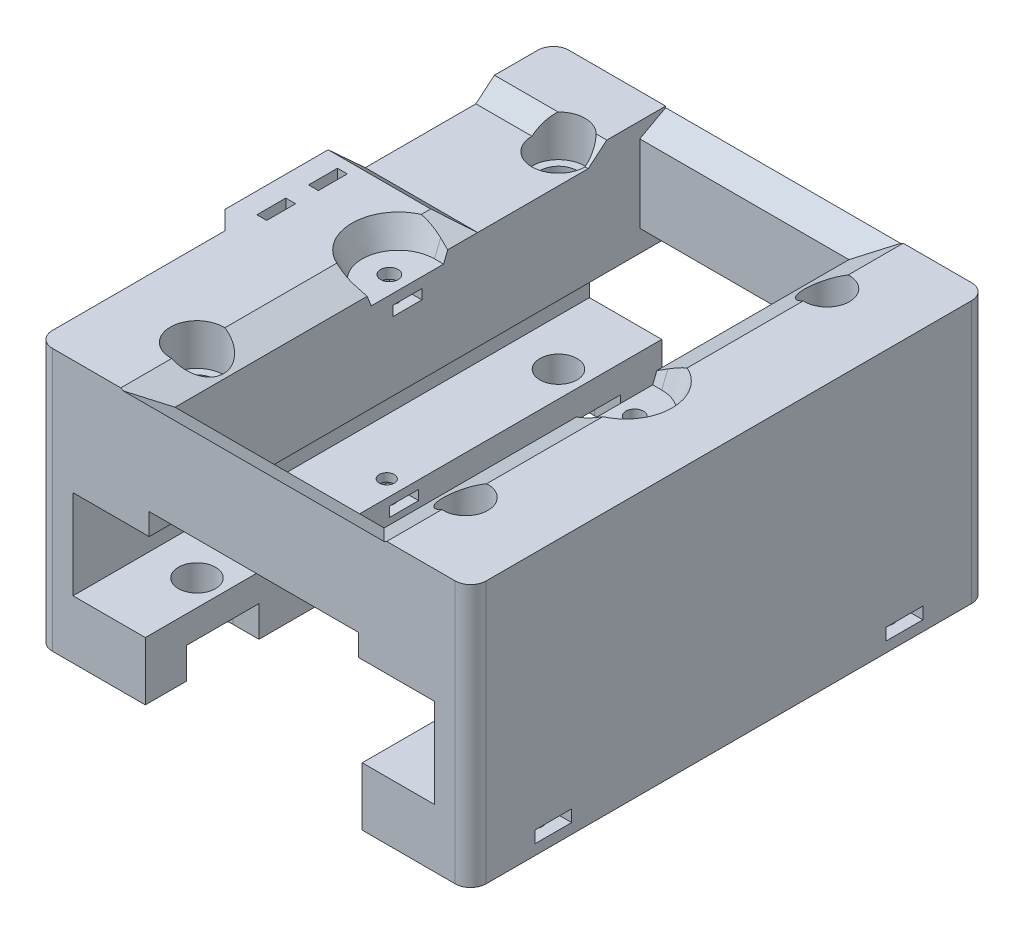
from build123d import *
from OCP.BRepFilletAPI import BRepFilletAPI_MakeChamfer

# Parameters (mm, degrees)
SKETCH_1_W                = 84
SKETCH_1_H                = 100
EXTRUDE_1_DEPTH           = 18
SKETCH_2_W                = 23
SKETCH_2_H                = 32.8
EXTRUDE_2_DEPTH           = 100
CUT_EXTRUDE_1_DEPTH       = 100
HOLE_WIZARD_1_D           = 4.6
HOLE_WIZARD_1_DEPTH       = 45
HOLE_WIZARD_1_CBORE_D     = 9.6
HOLE_WIZARD_1_CBORE_DEPTH = 6
CUT_EXTRUDE_3_REACH       = 84.732
SKETCH_12_W               = 40.5
SKETCH_12_H               = 90
SKETCH_13_OUTSIDE_W       = 114.026
SKETCH_13_OUTSIDE_H       = 130.026
SKETCH_13_OUTSIDE_W_2     = 84
SKETCH_13_OUTSIDE_H_2     = 100
CUT_EXTRUDE_4_DEPTH       = 5
HOLE_WIZARD_M31_D         = 3.4
HOLE_WIZARD_M31_DEPTH     = 6
HOLE_WIZARD_M31_TIP       = 1.021463052
SKETCH_16_R               = 2
CUT_EXTRUDE_6_DEPTH       = 8
SKETCH_17_W               = 7.1
SKETCH_17_H               = 2.3
CUT_EXTRUDE_7_DEPTH       = 7.93
SKETCH_18_W               = 20
SKETCH_18_H               = 15
EXTRUDE_3_DEPTH           = 3.6
SKETCH_21_W               = 21.75
SKETCH_21_H               = 21.4
CUT_EXTRUDE_9_DEPTH       = 3
FILLET_3_R                = 3
EXTRUDE_5_REACH           = 86.617
CHAMFER_1_SIZE            = 5
CHAMFER_1_SIZE_2          = 2
CHAMFER_2_SIZE            = 2
CHAMFER_2_SIZE_2          = 5
CHAMFER_4_SIZE            = 5.5
CHAMFER_4_SIZE_2          = 3
SKETCH_25_R               = 3.6
CUT_EXTRUDE_11_DEPTH      = 2.6
SKETCH_26_R               = 5.15
CUT_EXTRUDE_12_DEPTH      = 8
CUT_EXTRUDE_13_REACH      = 86.617
SKETCH_27_R               = 3.6
CUT_EXTRUDE_14_DEPTH      = 6
SKETCH_30_R               = 4.35
CUT_EXTRUDE_16_DEPTH      = 8
CUT_EXTRUDE_17_REACH      = 86.617
SKETCH_31_W               = 0.5
SKETCH_31_H               = 100
CUT_EXTRUDE_18_REACH      = 76.517
SKETCH_32_R               = 3.6
EXTRUDE_6_DEPTH           = 6
CUT_EXTRUDE_19_DEPTH      = 6
SKETCH_35_R               = 1
CUT_EXTRUDE_20_DEPTH      = 6
FILLET_4_R                = 10
FILLET_5_R                = 1
SKETCH_36_W               = 5.6
SKETCH_36_H               = 1.9
CUT_EXTRUDE_21_DEPTH      = 6
HOLE_WIZARD_M2_52_D       = 2.9
HOLE_WIZARD_M2_52_DEPTH   = 5.3
HOLE_WIZARD_M2_52_TIP     = 0.871247898
SKETCH_39_W               = 1
SKETCH_39_H               = 3.208176746
CUT_EXTRUDE_22_DEPTH      = 6
FILLET_6_R                = 0.5
SKETCH_41_W               = 5.6
SKETCH_41_H               = 1.9
CUT_EXTRUDE_23_DEPTH      = 6.3
CHAMFER_5_SIZE            = 3.6
CHAMFER_5_SIZE_2          = 3
SKETCH_42_W               = 1.9
SKETCH_42_H               = 5.6
CUT_EXTRUDE_24_DEPTH      = 7.75
SKETCH_43_R               = 1.55
CUT_EXTRUDE_25_DEPTH      = 10


# Some blends are built 0.0001 mm under size
with BuildPart() as part:
    # Эскиз1 → Бобышка-Вытянуть1 (new body)
    with BuildSketch(Plane(origin=(0, 0, 0), x_dir=(1, 0, 0), z_dir=(0, 1, 0))):
        Rectangle(SKETCH_1_W, SKETCH_1_H)
    extrude(amount=EXTRUDE_1_DEPTH)

    # Эскиз2 → Бобышка-Вытянуть2 (add)
    with BuildSketch(Plane.XY.offset(50)):
        with Locations((-30.5, -16.4)):
            Rectangle(SKETCH_2_W, SKETCH_2_H)
        with Locations((30.5, -16.4)):
            Rectangle(SKETCH_2_W, SKETCH_2_H)
    extrude(amount=-EXTRUDE_2_DEPTH)

    # Эскиз5 → Вырез-Вытянуть1 (cut)
    with BuildSketch(Plane.XY.offset(50)):
        Polygon((-20.5, -21.5), (-35, -21.5), (-35, -4.2), (-20.25, -4.2), (-20.25, 0), (-19, 0), (-19, -4.2), (-19, -32.8), (-20.5, -32.8), align=None)
        Polygon((20.5, -32.8), (20.5, -21.5), (35, -21.5), (35, -4.2), (20.25, -4.2), (20.25, 0), (19, 0), (19, -4.2), (19, -32.8), align=None)
    extrude(amount=-CUT_EXTRUDE_1_DEPTH, mode=Mode.SUBTRACT)

    # Отверстие1
    with Locations(Plane(origin=(0, -32.8, 0), x_dir=(-1, 0, 0), z_dir=(0, -1, 0))):
        with Locations((-26, -35), (-26, 35)):
            CounterBoreHole(HOLE_WIZARD_1_D / 2, HOLE_WIZARD_1_CBORE_D / 2, HOLE_WIZARD_1_CBORE_DEPTH, depth=HOLE_WIZARD_1_DEPTH)

    # Эскиз12 → Вырез-Вытянуть3 (cut, up to next)
    with BuildSketch(Plane(origin=(0, 18, 0), x_dir=(1, 0, 0), z_dir=(0, 1, 0)), mode=Mode.PRIVATE) as cut_extrude_3_sk1:
        Rectangle(SKETCH_12_W, SKETCH_12_H)
    cut_extrude_3_tool1 = extrude(cut_extrude_3_sk1.sketch, amount=-CUT_EXTRUDE_3_REACH, mode=Mode.PRIVATE) & part.part
    add(cut_extrude_3_tool1.solids().sort_by_distance((0, 18, 0))[0], mode=Mode.SUBTRACT)

    # Эскиз13 outside → Вырез-Вытянуть4 (cut)
    # profile 1 of 2: a face of its own
    with BuildSketch(Plane(origin=(0, 18, 0), x_dir=(1, 0, 0), z_dir=(0, 1, 0))):
        Rectangle(SKETCH_13_OUTSIDE_W, SKETCH_13_OUTSIDE_H)
        Rectangle(SKETCH_13_OUTSIDE_W_2, SKETCH_13_OUTSIDE_H_2, mode=Mode.SUBTRACT)
    # profile 2 of 2: a face of its own
    with BuildSketch(Plane(origin=(0, 18, 0), x_dir=(1, 0, 0), z_dir=(0, 1, 0))):
        with BuildLine():
            Line((20.25, 7), (22, 7))
            ThreePointArc((22, 7), (29, 0), (22, -7))
            Line((22, -7), (20.25, -7))
            Line((20.25, -7), (20.25, -45))
            Line((20.25, -45), (-20.25, -45))
            Line((-20.25, -45), (-20.25, -7))
            Line((-20.25, -7), (-22, -7))
            ThreePointArc((-22, -7), (-29, 0), (-22, 7))
            Line((-22, 7), (-20.25, 7))
            Line((-20.25, 7), (-20.25, 45))
            Line((-20.25, 45), (20.25, 45))
            Line((20.25, 45), (20.25, 7))
        make_face()
    extrude(amount=-CUT_EXTRUDE_4_DEPTH, mode=Mode.SUBTRACT)

    # Отверстие с зазором M31
    with Locations(Plane(origin=(0, 13, 0), x_dir=(1, 0, 0), z_dir=(0, 1, 0))):
        with Locations((-23.75, 0), (23.75, 0)):
            Hole(HOLE_WIZARD_M31_D / 2, depth=HOLE_WIZARD_M31_DEPTH)
            with Locations((0, 0, -(HOLE_WIZARD_M31_DEPTH + HOLE_WIZARD_M31_TIP / 2))):  # 118° drill point
                Cone(0, HOLE_WIZARD_M31_D / 2, HOLE_WIZARD_M31_TIP, mode=Mode.SUBTRACT)

    # Эскиз16 → Вырез-Вытянуть6 (cut)
    with BuildSketch(Plane.XZ.offset(32.8)):
        with Locations(Location((37.82, 34, 0), (0, 0, 270))):
            Circle(SKETCH_16_R)
        with Locations(Location((37.82, -34, 0), (0, 0, 270))):
            Circle(SKETCH_16_R)
    extrude(amount=-CUT_EXTRUDE_6_DEPTH, mode=Mode.SUBTRACT)

    # Эскиз17 → Вырез-Вытянуть7 (cut)
    with BuildSketch(Plane(origin=(42, 0, 0), x_dir=(0, 0, -1), z_dir=(1, 0, 0))):
        with Locations((-34, -29.65)):
            Rectangle(SKETCH_17_W, SKETCH_17_H)
        with Locations((34, -29.65)):
            Rectangle(SKETCH_17_W, SKETCH_17_H)
    extrude(amount=-CUT_EXTRUDE_7_DEPTH, mode=Mode.SUBTRACT)

    # Эскиз18 → Бобышка-Вытянуть3 (add)
    with BuildSketch(Plane.ZY.offset(42)):
        with Locations((0, 10.5)):
            Rectangle(SKETCH_18_W, SKETCH_18_H)
    extrude(amount=EXTRUDE_3_DEPTH)

    # Эскиз21 → Вырез-Вытянуть9 (cut)
    with BuildSketch(Plane(origin=(0, 18, 0), x_dir=(1, 0, 0), z_dir=(0, 1, 0))):
        with Locations((-31.125, 24.3)):
            Rectangle(SKETCH_21_W, SKETCH_21_H)
    extrude(amount=-CUT_EXTRUDE_9_DEPTH, mode=Mode.SUBTRACT)

    # Скругление3
    fillet_3_edges = [part.edges().sort_by_distance(p)[0] for p in [
        (-42, -7.4, -50),
        (42, -7.4, -50),
        (42, -7.4, 50),
        (-42, -7.4, 50),
    ]]
    fillet(fillet_3_edges, radius=FILLET_3_R)

    # Бобышка-Вытянуть5: up to this face of the body (flat: up to its plane)
    extrude_5_end = Plane(part.part.faces().sort_by_distance((-43.8, 3, 0))[0])
    # Эскиз23 → Бобышка-Вытянуть5 (add, up to the picked face)
    with BuildSketch(Plane(origin=(0, 18, 0), x_dir=(1, 0, 0), z_dir=(0, 1, 0)), mode=Mode.PRIVATE) as extrude_5_sk1:
        Polygon((-45.6, 10), (-42, 13.6), (-42, 10), align=None)
    extrude_5_tool1 = split(extrude(extrude_5_sk1.sketch, amount=-EXTRUDE_5_REACH, mode=Mode.PRIVATE), bisect_by=extrude_5_end, keep=Keep.BOTH, mode=Mode.PRIVATE)
    # Эскиз23 → Бобышка-Вытянуть5 (add, up to the picked face)
    with BuildSketch(Plane(origin=(0, 18, 0), x_dir=(1, 0, 0), z_dir=(0, 1, 0)), mode=Mode.PRIVATE) as extrude_5_sk2:
        Polygon((-45.6, -10), (-42, -10), (-42, -13.6), align=None)
    extrude_5_tool2 = split(extrude(extrude_5_sk2.sketch, amount=-EXTRUDE_5_REACH, mode=Mode.PRIVATE), bisect_by=extrude_5_end, keep=Keep.BOTH, mode=Mode.PRIVATE)
    add(extrude_5_tool1.solids().sort_by(Axis((-43.2, 18, -11.2), (0, -1, 0)))[0])
    add(extrude_5_tool2.solids().sort_by(Axis((-43.2, 18, 11.2), (0, -1, 0)))[0])

    # Фаска1
    chamfer_1_edges_1 = [part.edges().sort_by_distance(p)[0] for p in [
        (-21.125, 18, 7),
    ]]
    chamfer_1_side_1 = [part.faces().sort_by_distance(p)[0] for p in [
        (-21.125, 17.96, 7),
    ]]
    chamfer_1_edges_2 = [part.edges().sort_by_distance(p)[0] for p in [
        (-21.125, 18, -7),
    ]]
    chamfer_1_side_2 = [part.faces().sort_by_distance(p)[0] for p in [
        (-21.125, 17.96, -7),
    ]]
    chamfer_1_edges_3 = [part.edges().sort_by_distance(p)[0] for p in [
        (-29, 18, 0),
    ]]
    chamfer_1_side_3 = [part.faces().sort_by_distance(p)[0] for p in [
        (-29, 17.96, 0),
    ]]
    chamfer_1 = BRepFilletAPI_MakeChamfer(part.part.solid().wrapped)
    for e in chamfer_1_edges_1:
        chamfer_1.Add(CHAMFER_1_SIZE - 0.0001, CHAMFER_1_SIZE_2 - 0.0001, e.wrapped, chamfer_1_side_1[0].wrapped)
    for e in chamfer_1_edges_2:
        chamfer_1.Add(CHAMFER_1_SIZE - 0.0001, CHAMFER_1_SIZE_2 - 0.0001, e.wrapped, chamfer_1_side_2[0].wrapped)
    for e in chamfer_1_edges_3:
        chamfer_1.Add(CHAMFER_1_SIZE - 0.0001, CHAMFER_1_SIZE_2 - 0.0001, e.wrapped, chamfer_1_side_3[0].wrapped)
    add(Compound.cast(chamfer_1.Shape()), mode=Mode.REPLACE)  # a hair under: the kernel refuses the full size

    # Фаска2
    chamfer_2_edges_1 = [part.edges().sort_by_distance(p)[0] for p in [
        (21.125, 18, 7),
    ]]
    chamfer_2_side_1 = [part.faces().sort_by_distance(p)[0] for p in [
        (21.125, 18, 7.04),
    ]]
    chamfer_2_edges_2 = [part.edges().sort_by_distance(p)[0] for p in [
        (21.125, 18, -7),
    ]]
    chamfer_2_side_2 = [part.faces().sort_by_distance(p)[0] for p in [
        (21.125, 18, -7.04),
    ]]
    chamfer_2_edges_3 = [part.edges().sort_by_distance(p)[0] for p in [
        (29, 18, 0),
    ]]
    chamfer_2_side_3 = [part.faces().sort_by_distance(p)[0] for p in [
        (29.04, 18, 0),
    ]]
    chamfer_2 = BRepFilletAPI_MakeChamfer(part.part.solid().wrapped)
    for e in chamfer_2_edges_1:
        chamfer_2.Add(CHAMFER_2_SIZE - 0.0001, CHAMFER_2_SIZE_2 - 0.0001, e.wrapped, chamfer_2_side_1[0].wrapped)
    for e in chamfer_2_edges_2:
        chamfer_2.Add(CHAMFER_2_SIZE - 0.0001, CHAMFER_2_SIZE_2 - 0.0001, e.wrapped, chamfer_2_side_2[0].wrapped)
    for e in chamfer_2_edges_3:
        chamfer_2.Add(CHAMFER_2_SIZE - 0.0001, CHAMFER_2_SIZE_2 - 0.0001, e.wrapped, chamfer_2_side_3[0].wrapped)
    add(Compound.cast(chamfer_2.Shape()), mode=Mode.REPLACE)  # a hair under: the kernel refuses the full size

    # Фаска4
    # the kernel refuses this chamfer: 5.5, 3 mm, written as the material it takes off along each edge
    with BuildSketch(Plane(origin=(-20.25, 18, -5.235379082), x_dir=(-1, 0, 0), z_dir=(0, 0, 1)), Plane(origin=(20.25, 18, 45), x_dir=(1, 0, 0), z_dir=(0, 0, -1)), Plane(origin=(20.25, 18, 5.235379082), x_dir=(1, 0, 0), z_dir=(0, 0, -1))) as chamfer_4_piece_1:
        Polygon((CHAMFER_4_SIZE, 0), (0, CHAMFER_4_SIZE_2), (0, 0), align=None)
    extrude(amount=50.235379082, mode=Mode.SUBTRACT)
    with BuildSketch(Plane(origin=(-20.25, 18, 45), x_dir=(0, 0, 1), z_dir=(1, 0, 0)), Plane(origin=(20.25, 18, -45), x_dir=(0, 0, -1), z_dir=(-1, 0, 0))) as chamfer_4_piece_2:
        Polygon((CHAMFER_4_SIZE, 0), (0, CHAMFER_4_SIZE_2), (0, 0), align=None)
    extrude(amount=40.5, mode=Mode.SUBTRACT)
    with BuildSketch(Plane(origin=(-20.25, 18, -27.835279082), x_dir=(-1, 0, 0), z_dir=(0, 0, 1))) as chamfer_4_piece_3:
        Polygon((CHAMFER_4_SIZE, 0), (0, CHAMFER_4_SIZE_2), (0, 0), align=None)
    extrude(amount=33.070658164, mode=Mode.SUBTRACT)
    with BuildSketch(Plane(origin=(-34.485279082, 18, 45), x_dir=(0, 0, 1), z_dir=(1, 0, 0))) as chamfer_4_piece_4a_section:
        Polygon((CHAMFER_4_SIZE, 0), (0, CHAMFER_4_SIZE_2), (0, 0), align=None)
    chamfer_4_piece_4a = extrude(amount=54.735279082, mode=Mode.PRIVATE)
    chamfer_4_piece_4a = split(chamfer_4_piece_4a, bisect_by=Plane(origin=(-20.25, 18, 45), z_dir=(-1, 0, 0)), keep=Keep.TOP, mode=Mode.PRIVATE)
    chamfer_4_piece_4a = split(chamfer_4_piece_4a, bisect_by=Plane(origin=(-34.485279082, 18, 50), z_dir=(0, 0, -1)), keep=Keep.TOP, mode=Mode.PRIVATE)
    with BuildSketch(Plane(origin=(-20.25, 18, -5.235379082), x_dir=(-1, 0, 0), z_dir=(0, 0, 1))) as chamfer_4_piece_4b_section:
        Polygon((CHAMFER_4_SIZE, 0), (0, CHAMFER_4_SIZE_2), (0, 0), align=None)
    chamfer_4_piece_4b = extrude(amount=64.470658164, mode=Mode.PRIVATE)
    chamfer_4_piece_4b = split(chamfer_4_piece_4b, bisect_by=Plane(origin=(-20.25, 18, 45), z_dir=(0, 0, 1)), keep=Keep.TOP, mode=Mode.PRIVATE)
    chamfer_4_piece_4b = split(chamfer_4_piece_4b, bisect_by=Plane(origin=(-20.25, 18, 50), z_dir=(0, 0, -1)), keep=Keep.TOP, mode=Mode.PRIVATE)
    chamfer_4_piece_4 = chamfer_4_piece_4a & chamfer_4_piece_4b
    add(chamfer_4_piece_4, mode=Mode.SUBTRACT)
    with BuildSketch(Plane(origin=(20.25, 18, 59.235279082), x_dir=(1, 0, 0), z_dir=(0, 0, -1))) as chamfer_4_piece_5a_section:
        Polygon((CHAMFER_4_SIZE, 0), (0, CHAMFER_4_SIZE_2), (0, 0), align=None)
    chamfer_4_piece_5a = extrude(amount=64.470658164, mode=Mode.PRIVATE)
    chamfer_4_piece_5a = split(chamfer_4_piece_5a, bisect_by=Plane(origin=(20.25, 18, 45), z_dir=(0, 0, 1)), keep=Keep.TOP, mode=Mode.PRIVATE)
    chamfer_4_piece_5a = split(chamfer_4_piece_5a, bisect_by=Plane(origin=(20.25, 18, 50), z_dir=(0, 0, -1)), keep=Keep.TOP, mode=Mode.PRIVATE)
    with BuildSketch(Plane(origin=(-20.25, 18, 45), x_dir=(0, 0, 1), z_dir=(1, 0, 0))) as chamfer_4_piece_5b_section:
        Polygon((CHAMFER_4_SIZE, 0), (0, CHAMFER_4_SIZE_2), (0, 0), align=None)
    chamfer_4_piece_5b = extrude(amount=54.735279082, mode=Mode.PRIVATE)
    chamfer_4_piece_5b = split(chamfer_4_piece_5b, bisect_by=Plane(origin=(20.25, 18, 45), z_dir=(1, 0, 0)), keep=Keep.TOP, mode=Mode.PRIVATE)
    chamfer_4_piece_5b = split(chamfer_4_piece_5b, bisect_by=Plane(origin=(-20.25, 18, 50), z_dir=(0, 0, -1)), keep=Keep.TOP, mode=Mode.PRIVATE)
    chamfer_4_piece_5 = chamfer_4_piece_5a & chamfer_4_piece_5b
    add(chamfer_4_piece_5, mode=Mode.SUBTRACT)
    with BuildSketch(Plane(origin=(20.25, 18, 5.235379082), x_dir=(1, 0, 0), z_dir=(0, 0, -1))) as chamfer_4_piece_6a_section:
        Polygon((CHAMFER_4_SIZE, 0), (0, CHAMFER_4_SIZE_2), (0, 0), align=None)
    chamfer_4_piece_6a = extrude(amount=64.470658164, mode=Mode.PRIVATE)
    chamfer_4_piece_6a = split(chamfer_4_piece_6a, bisect_by=Plane(origin=(20.25, 18, -45), z_dir=(0, 0, -1)), keep=Keep.TOP, mode=Mode.PRIVATE)
    chamfer_4_piece_6a = split(chamfer_4_piece_6a, bisect_by=Plane(origin=(20.25, 18, -50), z_dir=(0, 0, 1)), keep=Keep.TOP, mode=Mode.PRIVATE)
    with BuildSketch(Plane(origin=(34.485279082, 18, -45), x_dir=(0, 0, -1), z_dir=(-1, 0, 0))) as chamfer_4_piece_6b_section:
        Polygon((CHAMFER_4_SIZE, 0), (0, CHAMFER_4_SIZE_2), (0, 0), align=None)
    chamfer_4_piece_6b = extrude(amount=54.735279082, mode=Mode.PRIVATE)
    chamfer_4_piece_6b = split(chamfer_4_piece_6b, bisect_by=Plane(origin=(20.25, 18, -45), z_dir=(1, 0, 0)), keep=Keep.TOP, mode=Mode.PRIVATE)
    chamfer_4_piece_6b = split(chamfer_4_piece_6b, bisect_by=Plane(origin=(34.485279082, 18, -50), z_dir=(0, 0, 1)), keep=Keep.TOP, mode=Mode.PRIVATE)
    chamfer_4_piece_6 = chamfer_4_piece_6a & chamfer_4_piece_6b
    add(chamfer_4_piece_6, mode=Mode.SUBTRACT)

    # Эскиз25 → Вырез-Вытянуть11 (cut)
    with BuildSketch(Plane.XZ.offset(4.2)):
        with Locations((-26, 35)):
            Circle(SKETCH_25_R)
        with Locations((-26, -35)):
            Circle(SKETCH_25_R)
    extrude(amount=-CUT_EXTRUDE_11_DEPTH, mode=Mode.SUBTRACT)

    # Эскиз26 → Вырез-Вытянуть12 (cut)
    with BuildSketch(Plane(origin=(0, 18, 0), x_dir=(1, 0, 0), z_dir=(0, 1, 0))):
        with Locations(Location((-26, -35, 0), (0, 0, 270))):
            Circle(SKETCH_26_R)
        with Locations(Location((-26, 35, 0), (0, 0, 270))):
            Circle(SKETCH_26_R)
    extrude(amount=-CUT_EXTRUDE_12_DEPTH, mode=Mode.SUBTRACT)

    # Эскиз27 → Вырез-Вытянуть13 (cut, up to next)
    with BuildSketch(Plane.XZ.offset(32.8), mode=Mode.PRIVATE) as cut_extrude_13_sk1:
        with Locations((-26, 35)):
            Circle(SKETCH_27_R)
    cut_extrude_13_tool1 = extrude(cut_extrude_13_sk1.sketch, amount=-CUT_EXTRUDE_13_REACH, mode=Mode.PRIVATE) & part.part
    # Эскиз27 → Вырез-Вытянуть13 (cut, up to next)
    with BuildSketch(Plane.XZ.offset(32.8), mode=Mode.PRIVATE) as cut_extrude_13_sk2:
        with Locations((-26, -35)):
            Circle(SKETCH_27_R)
    cut_extrude_13_tool2 = extrude(cut_extrude_13_sk2.sketch, amount=-CUT_EXTRUDE_13_REACH, mode=Mode.PRIVATE) & part.part
    add(cut_extrude_13_tool1.solids().sort_by_distance((-26, -32.8, 35))[0], mode=Mode.SUBTRACT)
    add(cut_extrude_13_tool2.solids().sort_by_distance((-26, -32.8, -35))[0], mode=Mode.SUBTRACT)

    # Эскиз28 → Вырез-Вытянуть14 (cut)
    with BuildSketch(Plane.XZ.offset(32.8)):
        with BuildLine():
            Line((-26, -28), (-20.5, -28))
            Line((-20.5, -28), (-20.5, -42))
            Line((-20.5, -42), (-26, -42))
            ThreePointArc((-26, -42), (-33, -35), (-26, -28))
        make_face()
        with BuildLine():
            Line((-26, 42), (-20.5, 42))
            Line((-20.5, 42), (-20.5, 28))
            Line((-20.5, 28), (-26, 28))
            ThreePointArc((-26, 28), (-33, 35), (-26, 42))
        make_face()
    extrude(amount=-CUT_EXTRUDE_14_DEPTH, mode=Mode.SUBTRACT)

    # Эскиз30 → Вырез-Вытянуть16 (cut)
    with BuildSketch(Plane(origin=(0, 18, 0), x_dir=(1, 0, 0), z_dir=(0, 1, 0))):
        with Locations(Location((26, -35, 0), (0, 0, 270))):
            Circle(SKETCH_30_R)
        with Locations(Location((26, 35, 0), (0, 0, 270))):
            Circle(SKETCH_30_R)
    extrude(amount=-CUT_EXTRUDE_16_DEPTH, mode=Mode.SUBTRACT)

    # Вырез-Вытянуть17: up to this face of the body (flat: up to its plane)
    cut_extrude_17_end = Plane(part.part.faces().sort_by_distance((-27.854125219, -21.5, 0))[0])
    # Эскиз31 → Вырез-Вытянуть17 (cut, up to the picked face)
    with BuildSketch(Plane.XZ.offset(32.8), mode=Mode.PRIVATE) as cut_extrude_17_sk1:
        with Locations((-20.75, 0)):
            Rectangle(SKETCH_31_W, SKETCH_31_H)
    cut_extrude_17_tool1 = split(extrude(cut_extrude_17_sk1.sketch, amount=-CUT_EXTRUDE_17_REACH, mode=Mode.PRIVATE), bisect_by=cut_extrude_17_end, keep=Keep.BOTH, mode=Mode.PRIVATE)
    # Эскиз31 → Вырез-Вытянуть17 (cut, up to the picked face)
    with BuildSketch(Plane.XZ.offset(32.8), mode=Mode.PRIVATE) as cut_extrude_17_sk2:
        with Locations((20.75, 0)):
            Rectangle(SKETCH_31_W, SKETCH_31_H)
    cut_extrude_17_tool2 = split(extrude(cut_extrude_17_sk2.sketch, amount=-CUT_EXTRUDE_17_REACH, mode=Mode.PRIVATE), bisect_by=cut_extrude_17_end, keep=Keep.BOTH, mode=Mode.PRIVATE)
    add(cut_extrude_17_tool1.solids().sort_by(Axis((-20.75, -32.8, 0), (0, 1, 0)))[0], mode=Mode.SUBTRACT)
    add(cut_extrude_17_tool2.solids().sort_by(Axis((20.75, -32.8, 0), (0, 1, 0)))[0], mode=Mode.SUBTRACT)

    # Эскиз32 → Вырез-Вытянуть18 (cut, up to next)
    with BuildSketch(Plane.XZ.offset(1.6), mode=Mode.PRIVATE) as cut_extrude_18_sk1:
        with Locations(Location((-26, 35, 0), (0, 0, 270))):
            Circle(SKETCH_32_R)
    cut_extrude_18_tool1 = extrude(cut_extrude_18_sk1.sketch, amount=-CUT_EXTRUDE_18_REACH, mode=Mode.PRIVATE) & part.part
    # Эскиз32 → Вырез-Вытянуть18 (cut, up to next)
    with BuildSketch(Plane.XZ.offset(1.6), mode=Mode.PRIVATE) as cut_extrude_18_sk2:
        with Locations(Location((-26, -35, 0), (0, 0, 270))):
            Circle(SKETCH_32_R)
    cut_extrude_18_tool2 = extrude(cut_extrude_18_sk2.sketch, amount=-CUT_EXTRUDE_18_REACH, mode=Mode.PRIVATE) & part.part
    add(cut_extrude_18_tool1.solids().sort_by_distance((-26, -1.6, 35))[0], mode=Mode.SUBTRACT)
    add(cut_extrude_18_tool2.solids().sort_by_distance((-26, -1.6, -35))[0], mode=Mode.SUBTRACT)

    # Эскиз33 → Бобышка-Вытянуть6 (add)
    with BuildSketch(Plane.XZ.offset(32.8)):
        with BuildLine():
            Line((23.8, 39.266145802), (28.2, 39.266145802))
            ThreePointArc((28.2, 39.266145802), (26, 39.8), (23.8, 39.266145802))
        make_face()
        with BuildLine():
            Line((23.40540936, 30.961671211), (21.20540936, 34.772182988))
            ThreePointArc((21.20540936, 34.772182988), (21.843078062, 32.6), (23.40540936, 30.961671211))
        make_face()
        with BuildLine():
            Line((23.8, 30.733854198), (28.2, 30.733854198))
            ThreePointArc((28.2, 30.733854198), (26, 30.2), (23.8, 30.733854198))
        make_face()
        with BuildLine():
            Line((21.20540936, 35.227817012), (23.40540936, 39.038328789))
            ThreePointArc((23.40540936, 39.038328789), (21.843078062, 37.4), (21.20540936, 35.227817012))
        make_face()
        with BuildLine():
            Line((28.59459064, 30.961671211), (30.79459064, 34.772182988))
            ThreePointArc((30.79459064, 34.772182988), (30.156921938, 32.6), (28.59459064, 30.961671211))
        make_face()
        with BuildLine():
            Line((30.79459064, 35.227817012), (28.59459064, 39.038328789))
            ThreePointArc((28.59459064, 39.038328789), (30.156921938, 37.4), (30.79459064, 35.227817012))
        make_face()
        with BuildLine():
            Line((30.79459064, -35.227817012), (28.59459064, -39.038328789))
            ThreePointArc((28.59459064, -39.038328789), (30.156921938, -37.4), (30.79459064, -35.227817012))
        make_face()
        with BuildLine():
            Line((28.59459064, -30.961671211), (30.79459064, -34.772182988))
            ThreePointArc((30.79459064, -34.772182988), (30.156921938, -32.6), (28.59459064, -30.961671211))
        make_face()
        with BuildLine():
            Line((21.20540936, -35.227817012), (23.40540936, -39.038328789))
            ThreePointArc((23.40540936, -39.038328789), (21.843078062, -37.4), (21.20540936, -35.227817012))
        make_face()
        with BuildLine():
            Line((23.8, -30.733854198), (28.2, -30.733854198))
            ThreePointArc((28.2, -30.733854198), (26, -30.2), (23.8, -30.733854198))
        make_face()
        with BuildLine():
            Line((23.40540936, -30.961671211), (21.20540936, -34.772182988))
            ThreePointArc((21.20540936, -34.772182988), (21.843078062, -32.6), (23.40540936, -30.961671211))
        make_face()
        with BuildLine():
            Line((23.8, -39.266145802), (28.2, -39.266145802))
            ThreePointArc((28.2, -39.266145802), (26, -39.8), (23.8, -39.266145802))
        make_face()
    extrude(amount=-EXTRUDE_6_DEPTH)

    # Эскиз34 → Вырез-Вытянуть19 (cut)
    with BuildSketch(Plane.XZ.offset(32.8)):
        Polygon((-35, 12), (-35, 18), (-21, 12), (20.390302787, 12), (35, 18), (35, 12), (35, -12), (35, -18), (21, -12), (-21, -12), (-35, -18), (-35, -12), align=None)
    extrude(amount=-CUT_EXTRUDE_19_DEPTH, mode=Mode.SUBTRACT)

    # Эскиз35 → Вырез-Вытянуть20 (cut)
    with BuildSketch(Plane.XZ.offset(32.8)):
        with Locations((-34.468238781, 17.15310567)):
            Circle(SKETCH_35_R)
        with Locations((-34.468238781, -17.15310567)):
            Circle(SKETCH_35_R)
        with Locations((34.468238781, 17.15310567)):
            Circle(SKETCH_35_R)
        with Locations((34.468238781, -17.15310567)):
            Circle(SKETCH_35_R)
    extrude(amount=-CUT_EXTRUDE_20_DEPTH, mode=Mode.SUBTRACT)

    # Скругление4
    fillet_4_edges = [part.edges().sort_by_distance(p)[0] for p in [
        (-33.488238598, -29.8, -17.352102256),
        (-33.488238598, -29.8, 17.352102256),
        (35, -29.8, 16.306211341),
        (35, -29.8, -16.306211341),
        (33.488238598, -29.8, -17.352102256),
        (33.494743308, -29.8, 17.381811955),
        (-35, -29.8, 16.306211341),
        (-35, -29.8, -16.306211341),
    ]]
    fillet(fillet_4_edges, radius=FILLET_4_R)

    # Скругление5
    fillet_5_edges = [part.edges().sort_by_distance(p)[0] for p in [
        (21, -29.8, 12.250394189),
        (-21, -29.8, 12),
        (21, -29.8, -12),
        (-21, -29.8, -12),
    ]]
    fillet(fillet_5_edges, radius=FILLET_5_R)

    # Эскиз36 → Вырез-Вытянуть21 (cut)
    with BuildSketch(Plane(origin=(-21, 0, 0), x_dir=(0, 0, -1), z_dir=(1, 0, 0))):
        with Locations((0.127124015, -24.05)):
            Rectangle(SKETCH_36_W, SKETCH_36_H)
    cut_extrude_21 = extrude(amount=-CUT_EXTRUDE_21_DEPTH, mode=Mode.SUBTRACT)

    # Отверстие с зазором M2.52
    with Locations(Plane(origin=(0, -26.8, 0), x_dir=(-1, 0, 0), z_dir=(0, -1, 0))):
        with Locations((24.25, 0), (-24.25, 0)):
            Hole(HOLE_WIZARD_M2_52_D / 2, depth=HOLE_WIZARD_M2_52_DEPTH)
            with Locations((0, 0, -(HOLE_WIZARD_M2_52_DEPTH + HOLE_WIZARD_M2_52_TIP / 2))):  # 118° drill point
                Cone(0, HOLE_WIZARD_M2_52_D / 2, HOLE_WIZARD_M2_52_TIP, mode=Mode.SUBTRACT)

    # Зеркальное отражение1: Вырез-Вытянуть21 across plane
    add(cut_extrude_21.mirror(Plane(origin=(0, 0, 0), x_dir=(0, 0, 1), z_dir=(1, 0, 0))), mode=Mode.SUBTRACT)

    # Эскиз39 → Вырез-Вытянуть22 (cut)
    with BuildSketch(Plane.XZ.offset(32.8)):
        with Locations((21.5, 35)):
            Rectangle(SKETCH_39_W, SKETCH_39_H)
        with Locations((21.5, -35)):
            Rectangle(SKETCH_39_W, SKETCH_39_H)
    extrude(amount=-CUT_EXTRUDE_22_DEPTH, mode=Mode.SUBTRACT)

    # Скругление6
    fillet_6_edges = [part.edges().sort_by_distance(p)[0] for p in [
        (22, -29.8, 36.604088373),
        (21, -29.8, 36.604088373),
        (21, -29.8, 33.395911627),
        (22, -29.8, 33.395911627),
        (22, -29.8, -36.604088373),
        (22, -29.8, -33.395911627),
        (21, -29.8, -33.395911627),
        (21, -29.8, -36.604088373),
    ]]
    fillet(fillet_6_edges, radius=FILLET_6_R)

    # Эскиз41 → Вырез-Вытянуть23 (cut)
    with BuildSketch(Plane.ZY.offset(-20.25)):
        with Locations((0, 10.05)):
            Rectangle(SKETCH_41_W, SKETCH_41_H)
    cut_extrude_23 = extrude(amount=-CUT_EXTRUDE_23_DEPTH, mode=Mode.SUBTRACT)

    # Зеркальное отражение2: Вырез-Вытянуть23 across plane
    add(cut_extrude_23.mirror(Plane(origin=(0, 0, 0), x_dir=(0, 0, 1), z_dir=(1, 0, 0))), mode=Mode.SUBTRACT)

    # Фаска5
    chamfer_5_edges_1 = [part.edges().sort_by_distance(p)[0] for p in [
        (-20.55, 18, -35),
    ]]
    chamfer_5_side_1 = [part.faces().sort_by_distance(p)[0] for p in [
        (-20.55, 18, -35.06),
    ]]
    chamfer_5_edges_2 = [part.edges().sort_by_distance(p)[0] for p in [
        (-36.575, 18, -35),
    ]]
    chamfer_5_side_2 = [part.faces().sort_by_distance(p)[0] for p in [
        (-36.575, 18, -35.06),
    ]]
    chamfer_5_edges_3 = [part.edges().sort_by_distance(p)[0] for p in [
        (-33.875, 18, -13.6),
    ]]
    chamfer_5_side_3 = [part.faces().sort_by_distance(p)[0] for p in [
        (-33.875, 18, -13.54),
    ]]
    chamfer_5 = BRepFilletAPI_MakeChamfer(part.part.solid().wrapped)
    for e in chamfer_5_edges_1:
        chamfer_5.Add(CHAMFER_5_SIZE - 0.0001, CHAMFER_5_SIZE_2 - 0.0001, e.wrapped, chamfer_5_side_1[0].wrapped)
    for e in chamfer_5_edges_2:
        chamfer_5.Add(CHAMFER_5_SIZE - 0.0001, CHAMFER_5_SIZE_2 - 0.0001, e.wrapped, chamfer_5_side_2[0].wrapped)
    for e in chamfer_5_edges_3:
        chamfer_5.Add(CHAMFER_5_SIZE - 0.0001, CHAMFER_5_SIZE_2 - 0.0001, e.wrapped, chamfer_5_side_3[0].wrapped)
    add(Compound.cast(chamfer_5.Shape()), mode=Mode.REPLACE)  # a hair under: the kernel refuses the full size

    # Эскиз42 → Вырез-Вытянуть24 (cut)
    with BuildSketch(Plane(origin=(0, 18, 0), x_dir=(1, 0, 0), z_dir=(0, 1, 0))):
        with Locations((-40.65, 5)):
            Rectangle(SKETCH_42_W, SKETCH_42_H)
        with Locations((-40.65, -5)):
            Rectangle(SKETCH_42_W, SKETCH_42_H)
    extrude(amount=-CUT_EXTRUDE_24_DEPTH, mode=Mode.SUBTRACT)

    # Эскиз43 → Вырез-Вытянуть25 (cut)
    with BuildSketch(Plane.ZY.offset(45.6)):
        with Locations((-5, 13)):
            Circle(SKETCH_43_R)
        with Locations((5, 13)):
            Circle(SKETCH_43_R)
    extrude(amount=-CUT_EXTRUDE_25_DEPTH, mode=Mode.SUBTRACT)


solid = part.part
